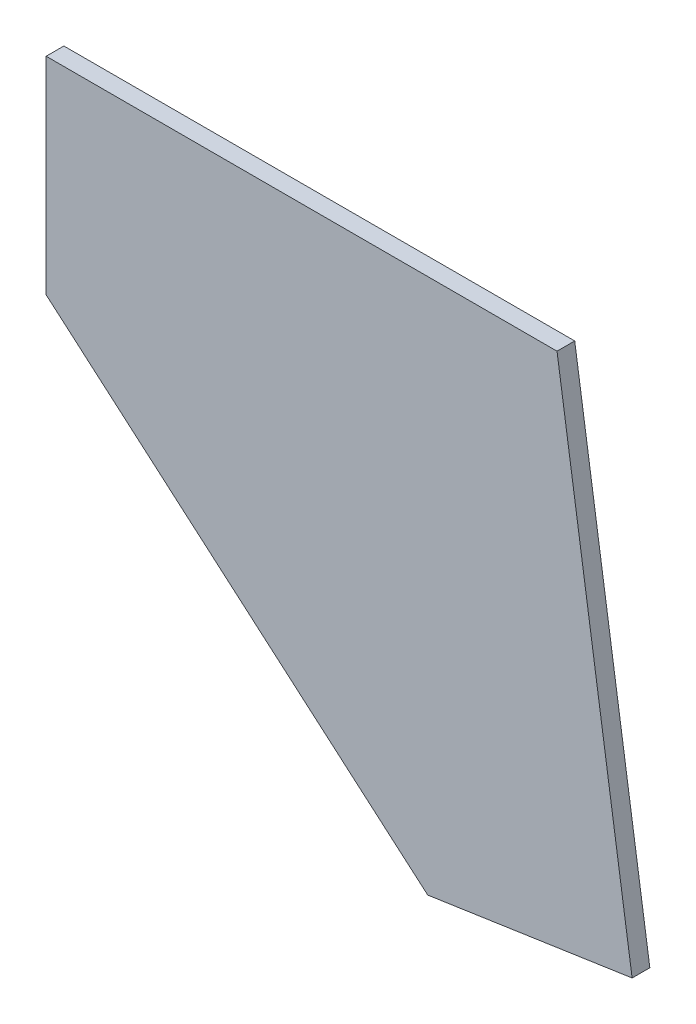
from build123d import *

# Parameters (mm, degrees)
SM_BASE_FLANGE_1_DEPTH = 6


# Sheet-metal steps are written as plain solids
with BuildPart() as part:
    # Sketch 1 → Базовая кромка1 (new body)
    with BuildSketch(Plane.XY):
        Polygon((-43.116918841, -50), (-216.167156359, -50), (-216.167156359, -120), (-86.91185076, -231.461810426), (-17.672650067, -221.169430365), align=None)
    extrude(amount=-SM_BASE_FLANGE_1_DEPTH)


solid = part.part
